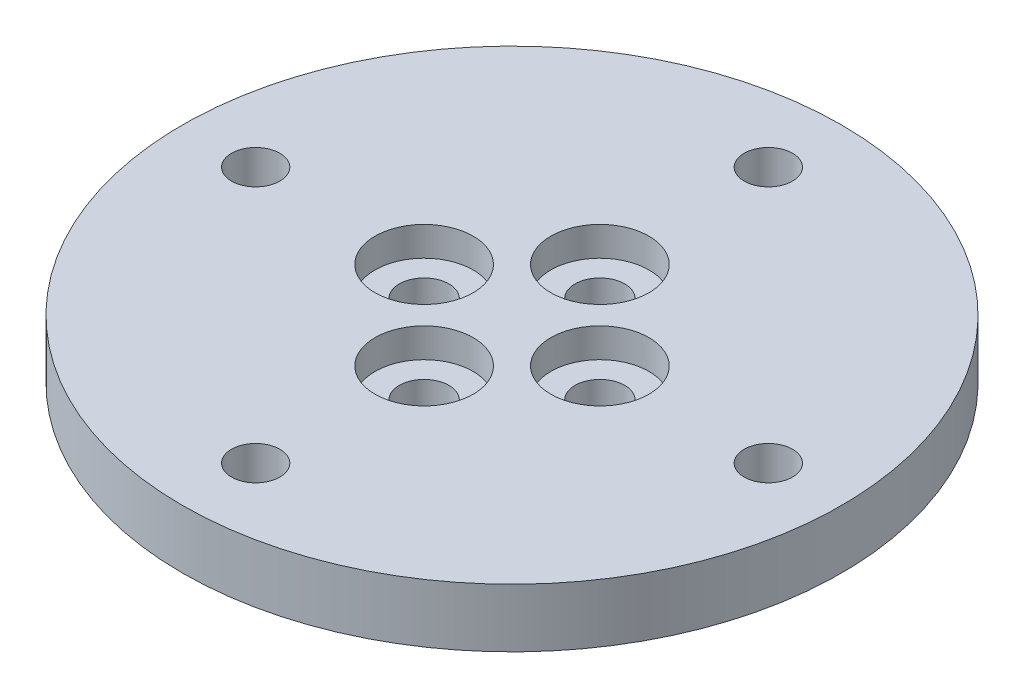
from build123d import *

# Parameters (mm, degrees)
SKETCH_1_R                  = 22.5
EXTRUDE_1_DEPTH             = 4
HOLE_WIZARD_M31_D           = 3.4
HOLE_WIZARD_M31_CBORE_D     = 6.7
HOLE_WIZARD_M31_CBORE_DEPTH = 2
M4X0_71_D                   = 3.3


with BuildPart() as part:
    # Эскиз1 → Бобышка-Вытянуть1 (new body)
    with BuildSketch(Plane(origin=(0, 0, 0), x_dir=(1, 0, 0), z_dir=(0, 1, 0))):
        Circle(SKETCH_1_R)
    extrude(amount=EXTRUDE_1_DEPTH)

    # Цековка для  винта с полукруглой головкой M31 (through all)
    with Locations(Plane(origin=(0, 4, 0), x_dir=(1, 0, 0), z_dir=(0, 1, 0))):
        with Locations((0, 6), (-6, 0), (0, -6), (6, 0)):
            CounterBoreHole(HOLE_WIZARD_M31_D / 2, HOLE_WIZARD_M31_CBORE_D / 2, HOLE_WIZARD_M31_CBORE_DEPTH)

    # Отверстие обработанное метчиком M4x0.71 (through all)
    with Locations(Plane(origin=(0, 4, 0), x_dir=(1, 0, 0), z_dir=(0, 1, 0))):
        with Locations((-17.5, 0), (0, -17.5), (17.5, 0), (0, 17.5)):
            Hole(M4X0_71_D / 2)


solid = part.part
